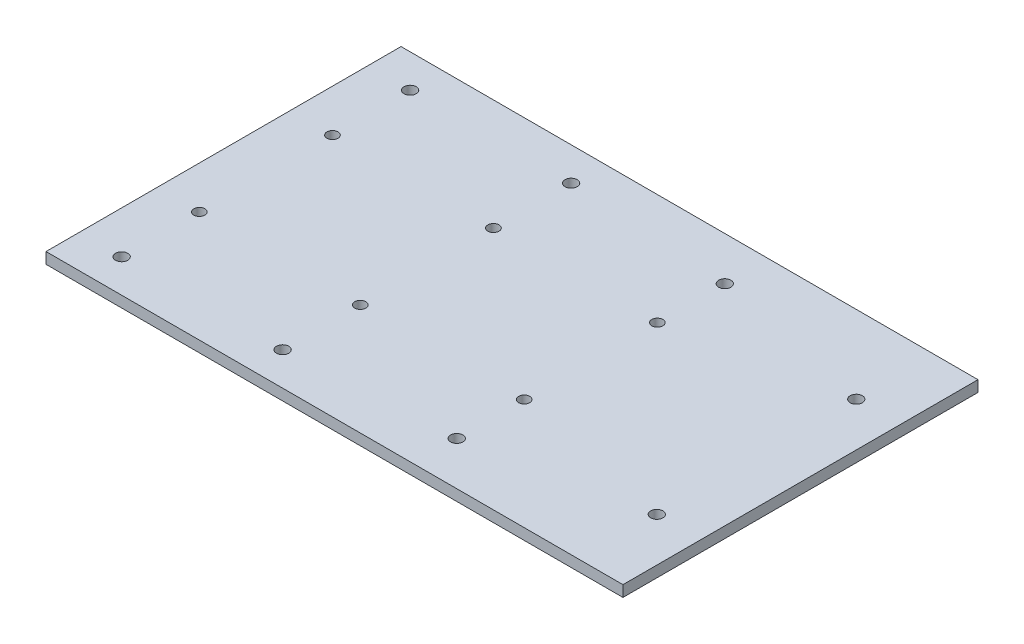
from build123d import *

# Parameters (mm, degrees)
SKETCH1_W                      = 330.2
SKETCH1_H                      = 203.2
BOSS_EXTRUDE1_DEPTH            = 6.35
F_1_4_0_25_PRESS_DOWEL_HOLE1_D = 6.35
M8X1_0_TAPPED_HOLE1_D          = 7


with BuildPart() as part:
    # Sketch1 → Boss-Extrude1 (new body)
    with BuildSketch(Plane(origin=(0, 0, 0), x_dir=(1, 0, 0), z_dir=(0, 1, 0))):
        Rectangle(SKETCH1_W, SKETCH1_H)
    extrude(amount=BOSS_EXTRUDE1_DEPTH)

    # 1/4 (0.25) Press Dowel Hole1 (through all)
    with Locations(Plane(origin=(0, 6.35, 0), x_dir=(1, 0, 0), z_dir=(0, 1, 0))):
        with Locations((-140.851357942, 38.099999999), (-140.851767246, -38.099999999), (-48.715925188, -38.100494903), (-48.715925188, 38.099505098), (45.084279464, 38.099001255), (45.08387016, -38.100998744)):
            Hole(F_1_4_0_25_PRESS_DOWEL_HOLE1_D / 2)

    # M8x1.0 Tapped Hole1 (through all)
    with Locations(Plane(origin=(0, 6.35, 0), x_dir=(1, 0, 0), z_dir=(0, 1, 0))):
        with Locations((-140.851562594, 82.55), (-48.715925188, 82.55), (45.084074812, 76.699001256), (45.084074812, -76.700998744), (-48.715925188, -82.55), (-140.851562594, -82.55), (139.954074812, 57.072042721), (139.954074812, -57.072042721)):
            Hole(M8X1_0_TAPPED_HOLE1_D / 2)


solid = part.part
